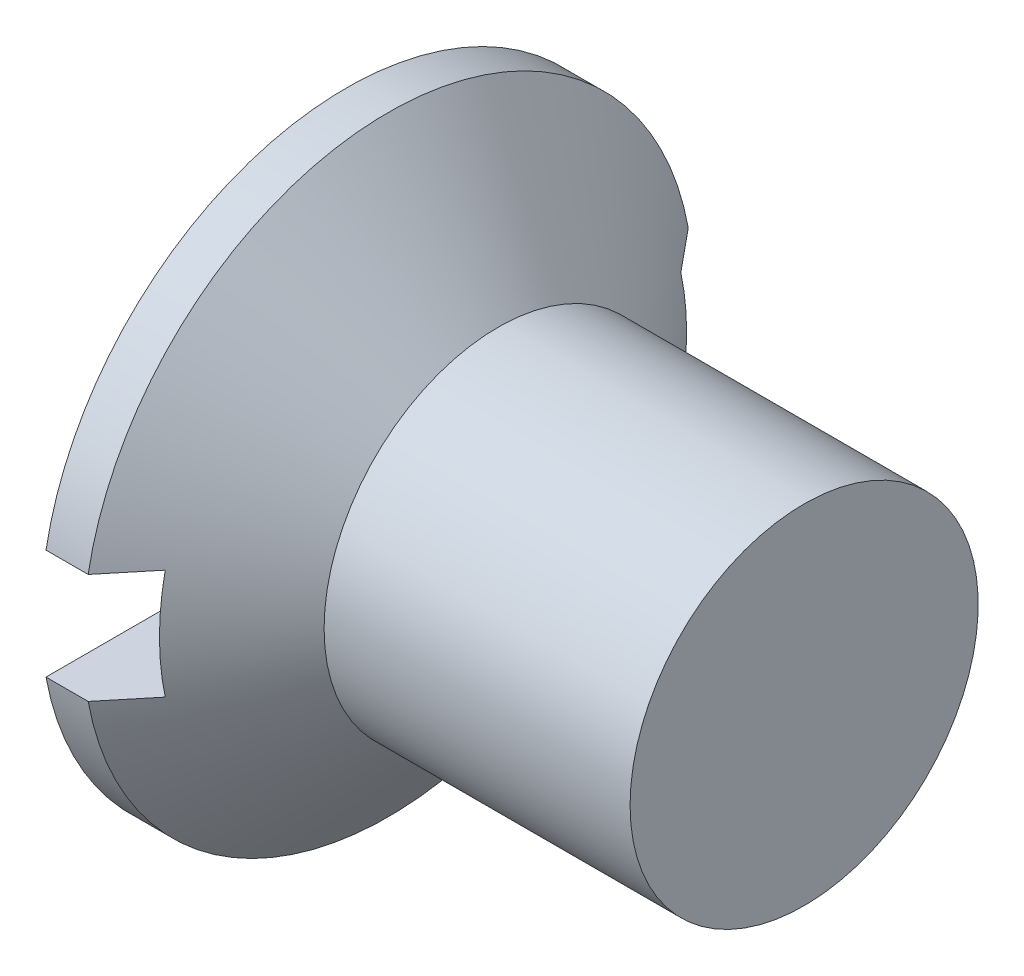
from build123d import *

# Parameters (mm, degrees)
SKETCH2_W         = 8.4582
SKETCH2_H         = 1.524
SLOT_DEPTH        = 1.0668
CIRPATTERN1_COUNT = 2
CIRPATTERN1_ANGLE = 90


with BuildPart() as part:
    # BodySke → Base-Revolve (revolve)
    with BuildSketch(Plane.XY):
        Polygon((0, 0), (0, 4.2291), (0.58431116, 4.2291), (2.1082, 2.413), (6.35, 2.413), (6.35, 0), align=None)
    revolve(axis=Axis((-6.35, 0, 0), (1, 0, 0)))

    # Sketch2 → Slot (cut)
    with BuildSketch(Plane.ZY):
        Rectangle(SKETCH2_W, SKETCH2_H)
    extrude(amount=-SLOT_DEPTH, mode=Mode.SUBTRACT)

    # Sketch3 → Cross section 0
    with BuildSketch(Plane.ZY):
        with BuildLine():
            Line((-0.5334, 2.8575), (0.5334, 2.8575))
            Line((0.5334, 2.8575), (0.5334, -2.8575))
            Line((0.5334, -2.8575), (-0.5334, -2.8575))
            Line((-0.5334, -2.8575), (-0.5334, 2.8575))
        make_face()
    # Sketch4 → Cross section 1
    with BuildSketch(Plane.ZY.offset(-3.7338)):
        with BuildLine():
            Line((-0.2667, 0.2667), (0.2667, 0.2667))
            Line((0.2667, 0.2667), (0.2667, -0.2667))
            Line((0.2667, -0.2667), (-0.2667, -0.2667))
            Line((-0.2667, -0.2667), (-0.2667, 0.2667))
        make_face()
    cross = loft(mode=Mode.SUBTRACT)

    # CirPattern1: Cross ×2 about axis
    cirpattern1_axis = Axis((-6.35, 0, 0), (1, 0, 0))
    for i in range(1, CIRPATTERN1_COUNT):
        add(cross.rotate(cirpattern1_axis, i * CIRPATTERN1_ANGLE / (CIRPATTERN1_COUNT - 1)), mode=Mode.SUBTRACT)


solid = part.part
